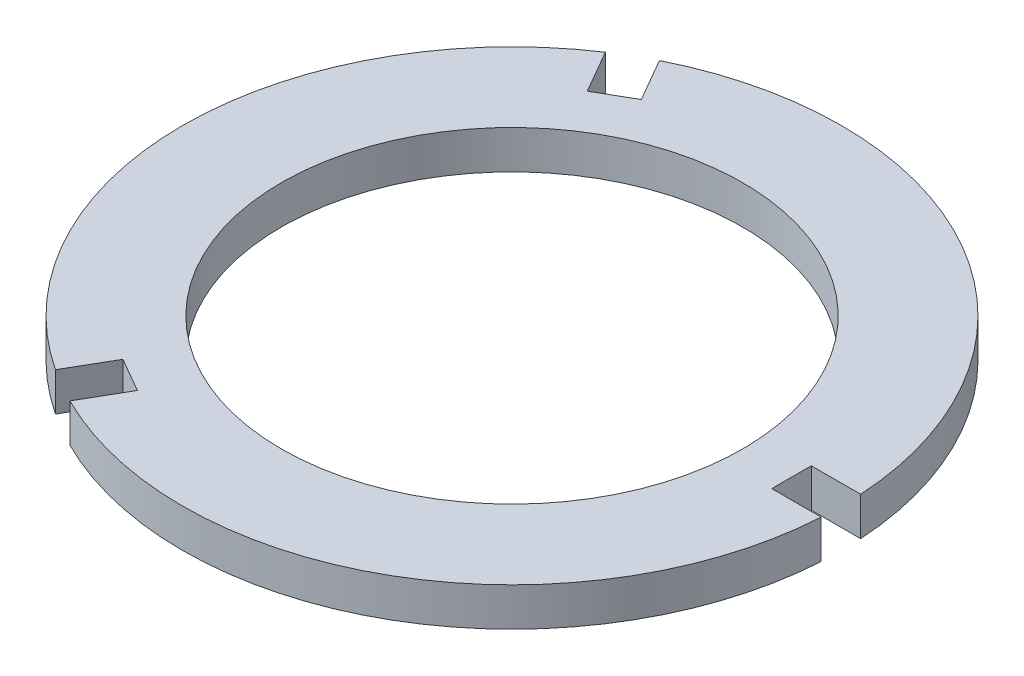
from build123d import *

# Parameters (mm, degrees)
CROQUIS1_R              = 30
CROQUIS1_R_2            = 21
SALIENTE_EXTRUIR1_DEPTH = 3.5
CORTAR_EXTRUIR2_REACH   = 44.571
CROQUIS2_W              = 9.1
CROQUIS2_H              = 3.6
MATRIZC1_COUNT          = 3


with BuildPart() as part:
    # Croquis1 → Saliente-Extruir1 (new body)
    with BuildSketch(Plane(origin=(0, 0, 0), x_dir=(1, 0, 0), z_dir=(0, 1, 0))):
        Circle(CROQUIS1_R)
        Circle(CROQUIS1_R_2, mode=Mode.SUBTRACT)
    extrude(amount=SALIENTE_EXTRUIR1_DEPTH)

    # Croquis2 → Cortar-Extruir2 (cut, up to next)
    with BuildSketch(Plane(origin=(0, 0, 0), x_dir=(1, 0, 0), z_dir=(0, 1, 0)), mode=Mode.PRIVATE) as cortar_extruir2_sk1:
        with Locations((30, 0)):
            Rectangle(CROQUIS2_W, CROQUIS2_H)
    cortar_extruir2_tool1 = extrude(cortar_extruir2_sk1.sketch, amount=CORTAR_EXTRUIR2_REACH, mode=Mode.PRIVATE) & part.part
    cortar_extruir2 = cortar_extruir2_tool1.solids().sort_by_distance((30, 0, 0))[0]
    add(cortar_extruir2, mode=Mode.SUBTRACT)

    # MatrizC1: Cortar-Extruir2 ×3 about axis
    matrizc1_axis = Axis((0, -0.3, 0), (0, 1, 0))
    for i in range(1, MATRIZC1_COUNT):
        add(cortar_extruir2.rotate(matrizc1_axis, i * 360 / MATRIZC1_COUNT), mode=Mode.SUBTRACT)


solid = part.part
